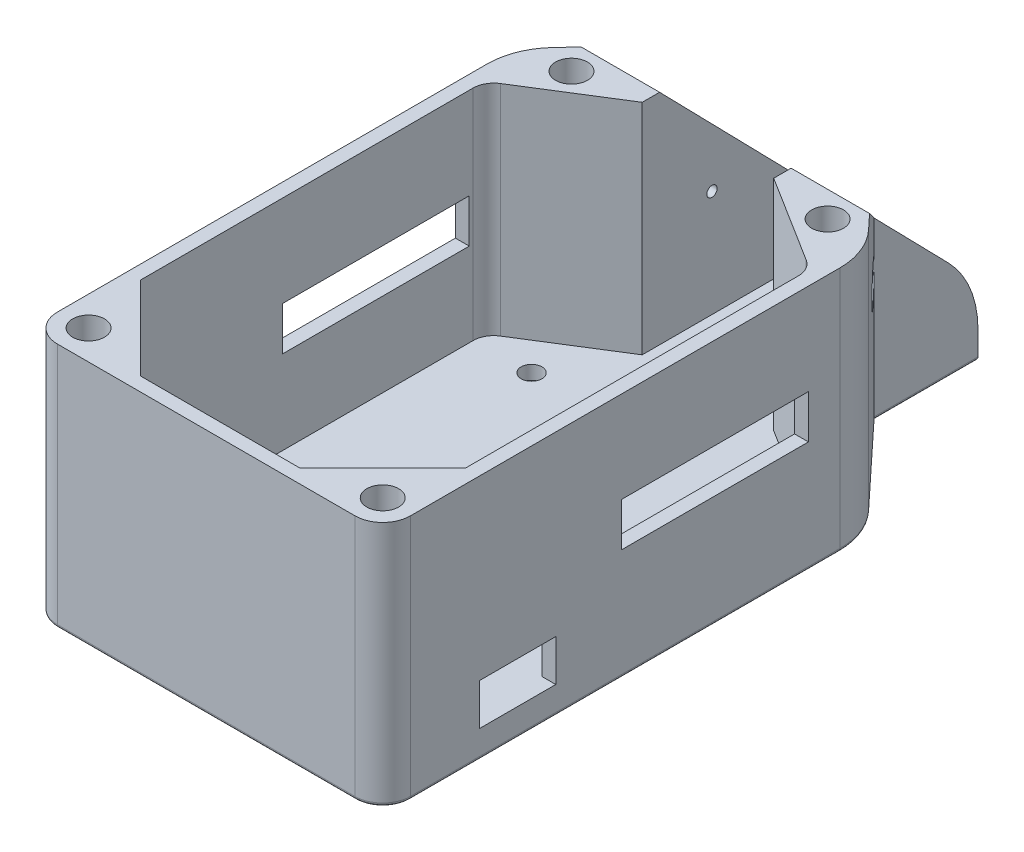
from build123d import *

# Parameters (mm, degrees)
SKETCH1_R               = 1.25
BOSS_EXTRUDE1_DEPTH     = 4
BOSS_EXTRUDE2_DEPTH     = 31.6
CUT_EXTRUDE1_DEPTH      = 119.025653029
FILLET1_R               = 15
FILLET2_R               = 3
FILLET3_R               = 3
SKETCH4_R               = 3.25
CUT_EXTRUDE2_DEPTH      = 2
SKETCH5_R               = 1.5
CUT_EXTRUDE3_DEPTH      = 117.536856073
CHAMFER1_SIZE           = 12
SKETCH6_R               = 2.3
CUT_EXTRUDE4_DEPTH      = 7
FILLET4_R               = 10
FILLET5_R               = 4
CUT_EXTRUDE5_DEPTH      = 113.685645816
CUT_EXTRUDE5_DEPTH_BACK = 113.685645816
SKETCH8_R               = 0.75
SKETCH9_R               = 2.5
CUT_EXTRUDE6_DEPTH      = 113.685645816
CUT_EXTRUDE7_START      = -23
SKETCH9_2_R             = 2.5
CUT_EXTRUDE7_DEPTH      = 90.685645816
SKETCH10_W              = 27
SKETCH10_H              = 6.3
CUT_EXTRUDE8_DEPTH      = 119.025653029
FILLET6_R               = 0.5
SKETCH11_W              = 11
SKETCH11_H              = 6
CUT_EXTRUDE9_DEPTH      = 118.175316416


with BuildPart() as part:
    # Sketch1 → Boss-Extrude1 (new body)
    # profile 1 of 3: a face of its own
    with BuildSketch(Plane.XZ.offset(17.94547529)):
        Polygon((3.055310961, 4.151096428), (26.055310961, 4.151096428), (26.055310961, 19.151096428), (40.055310961, 34.151096428), (40.055310961, 104.151096428), (-10.944689039, 104.151096428), (-10.944689039, 34.151096428), (3.055310961, 19.151096428), align=None)
        with BuildLine():
            ThreePointArc((1.805310961, 41.901096428), (1.47037447, 40.651096428), (0.555310961, 39.736032919))
            ThreePointArc((0.555310961, 39.736032919), (-0.694689039, 39.401096428), (-1.944689039, 39.736032919))
            ThreePointArc((-1.944689039, 39.736032919), (-2.859752549, 40.651096428), (-3.194689039, 41.901096428))
            ThreePointArc((-3.194689039, 41.901096428), (-2.859752549, 43.151096428), (-1.944689039, 44.066159938))
            ThreePointArc((-1.944689039, 44.066159938), (-0.694689039, 44.401096428), (0.555310961, 44.066159938))
            ThreePointArc((0.555310961, 44.066159938), (1.47037447, 43.151096428), (1.805310961, 41.901096428))
        make_face(mode=Mode.SUBTRACT)
    # profile 2 of 3: a face of its own
    with BuildSketch(Plane.XZ.offset(17.94547529)):
        with BuildLine():
            ThreePointArc((-1.944689039, 39.736032919), (-0.694689039, 39.401096428), (0.555310961, 39.736032919))
            ThreePointArc((0.555310961, 39.736032919), (1.47037447, 40.651096428), (1.805310961, 41.901096428))
            ThreePointArc((1.805310961, 41.901096428), (1.47037447, 43.151096428), (0.555310961, 44.066159938))
            ThreePointArc((0.555310961, 44.066159938), (-0.694689039, 44.401096428), (-1.944689039, 44.066159938))
            ThreePointArc((-1.944689039, 44.066159938), (-2.859752549, 43.151096428), (-3.194689039, 41.901096428))
            ThreePointArc((-3.194689039, 41.901096428), (-2.859752549, 40.651096428), (-1.944689039, 39.736032919))
        make_face()
        with Locations((-0.694689039, 41.901096428)):
            Circle(SKETCH1_R, mode=Mode.SUBTRACT)
    # profile 3 of 3: a face of its own
    with BuildSketch(Plane.XZ.offset(17.94547529)):
        with Locations((-0.694689039, 41.901096428)):
            Circle(SKETCH1_R)
    extrude(amount=BOSS_EXTRUDE1_DEPTH)

    # Sketch2 → Boss-Extrude2 (add)
    with BuildSketch(Plane(origin=(0, -17.94547529, 0), x_dir=(1, 0, 0), z_dir=(0, 1, 0))):
        Polygon((3.055310961, -4.151096428), (3.055310961, -19.151096428), (-10.944689039, -34.151096428), (-10.944689039, -104.151096428), (40.055310961, -104.151096428), (40.055310961, -34.151096428), (26.055310961, -19.151096428), (26.055310961, -4.151096428), align=None)
        Polygon((5.055310961, -31.664156806), (5.055310961, -6.151096428), (24.055310961, -6.151096428), (24.055310961, -31.664156806), (38.055310961, -40.43942279), (38.055310961, -102.151096428), (-8.944689039, -102.151096428), (-8.944689039, -40.43942279), align=None, mode=Mode.SUBTRACT)
    extrude(amount=BOSS_EXTRUDE2_DEPTH)

    # Sketch3 → Cut-Extrude1 (cut, through all)
    with BuildSketch(Plane.ZY.offset(10.944689039)):
        Polygon((29.151096428, 13.65452471), (4.151096428, -11.94547529), (4.151096428, 13.65452471), align=None)
    extrude(amount=-CUT_EXTRUDE1_DEPTH, mode=Mode.SUBTRACT)

    # Fillet1
    # the kernel refuses this fillet: 15 mm, written as the material it takes off along each edge
    with BuildSketch(Plane(origin=(-12.217866698, -11.94547529, 4.151096428), x_dir=(0, 0.7154411509611464, 0.6986729989854984), z_dir=(1, 0, 0))) as fillet1_piece_1:
        with BuildLine():
            CenterArc((FILLET1_R * 0.40728473757, FILLET1_R), FILLET1_R, 225.679364755, 44.320635245)
            Line((-FILLET1_R * 0.291388261416, FILLET1_R * 0.284558849039), (0, 0))
            Line((0, 0), (FILLET1_R * 0.40728473757, 0))
        make_face()
    extrude(amount=53.546355318, mode=Mode.SUBTRACT)

    # Fillet2
    fillet2_edges = [part.edges().sort_by_distance(p)[0] for p in [
        (5.055310961, -14.258453435, 6.151096428),
        (24.055310961, -14.258453435, 6.151096428),
    ]]
    fillet(fillet2_edges, radius=FILLET2_R)

    # Fillet3
    fillet3_edges = [part.edges().sort_by_distance(p)[0] for p in [
        (-8.944689039, -2.14547529, 40.43942279),
        (38.055310961, -2.14547529, 40.43942279),
    ]]
    fillet(fillet3_edges, radius=FILLET3_R)

    # Sketch4 → Cut-Extrude2 (cut)
    with BuildSketch(Plane.XZ.offset(21.94547529)):
        with Locations(Location((-0.694689039, 41.901096428, 0), (0, 0, 270))):
            Circle(SKETCH4_R)
        with Locations(Location((-0.694689039, 72.401096428, 0), (0, 0, 270))):
            Circle(SKETCH4_R)
        with Locations(Location((29.805310961, 72.401096428, 0), (0, 0, 270))):
            Circle(SKETCH4_R)
        with Locations(Location((29.805310961, 41.901096428, 0), (0, 0, 270))):
            Circle(SKETCH4_R)
    extrude(amount=-CUT_EXTRUDE2_DEPTH, mode=Mode.SUBTRACT)

    # Sketch5 → Cut-Extrude3 (cut, through all)
    with BuildSketch(Plane.XZ.offset(19.94547529)):
        with Locations(Location((-0.694689039, 41.901096428, 0), (0, 0, 270))):
            Circle(SKETCH5_R)
        with Locations(Location((-0.694689039, 72.401096428, 0), (0, 0, 270))):
            Circle(SKETCH5_R)
        with Locations(Location((29.805310961, 72.401096428, 0), (0, 0, 270))):
            Circle(SKETCH5_R)
        with Locations(Location((29.805310961, 41.901096428, 0), (0, 0, 270))):
            Circle(SKETCH5_R)
    extrude(amount=-CUT_EXTRUDE3_DEPTH, mode=Mode.SUBTRACT)

    # Chamfer1
    chamfer1_edges = [part.edges().sort_by_distance(p)[0] for p in [
        (-8.944689039, -2.14547529, 102.151096428),
        (38.055310961, -2.14547529, 102.151096428),
    ]]
    chamfer(chamfer1_edges, length=CHAMFER1_SIZE)

    # Sketch6 → Cut-Extrude4 (cut)
    with BuildSketch(Plane(origin=(0, 13.65452471, 0), x_dir=(1, 0, 0), z_dir=(0, 1, 0))):
        with Locations(Location((33.055310961, -32.881452384, 0), (0, 0, 270))):
            Circle(SKETCH6_R)
        with Locations(Location((-3.944689039, -32.881452384, 0), (0, 0, 270))):
            Circle(SKETCH6_R)
        with Locations(Location((35.805310961, -99.901096428, 0), (0, 0, 270))):
            Circle(SKETCH6_R)
        with Locations(Location((-6.694689039, -99.901096428, 0), (0, 0, 270))):
            Circle(SKETCH6_R)
    extrude(amount=-CUT_EXTRUDE4_DEPTH, mode=Mode.SUBTRACT)

    # Fillet4
    fillet4_edges = [part.edges().sort_by_distance(p)[0] for p in [
        (-10.944689039, -4.14547529, 34.151096428),
        (40.055310961, -4.14547529, 34.151096428),
    ]]
    fillet(fillet4_edges, radius=FILLET4_R)

    # Fillet5
    fillet5_edges = [part.edges().sort_by_distance(p)[0] for p in [
        (-10.944689039, -4.14547529, 104.151096428),
        (40.055310961, -4.14547529, 104.151096428),
    ]]
    fillet(fillet5_edges, radius=FILLET5_R)

    # Sketch8 → Cut-Extrude5 (cut, two sides: drawn at the far end of the back side and taken through both)
    with BuildSketch(Plane.ZY.offset(-3.055310961).offset(-CUT_EXTRUDE5_DEPTH_BACK)):
        with Locations((21.586066765, -2.525992097)):
            Circle(SKETCH8_R)
    extrude(amount=CUT_EXTRUDE5_DEPTH + CUT_EXTRUDE5_DEPTH_BACK, mode=Mode.SUBTRACT)

    # Sketch9 → Cut-Extrude6 (cut, through all)
    with BuildSketch(Plane.ZY.offset(-3.055310961)):
        with Locations((21.586066765, -2.525992097)):
            Circle(SKETCH9_R)
    extrude(amount=CUT_EXTRUDE6_DEPTH, mode=Mode.SUBTRACT)

    # Sketch9<2> → Cut-Extrude7 (cut, through all)
    with BuildSketch(Plane.ZY.offset(-3.055310961).offset(CUT_EXTRUDE7_START)):
        with Locations((21.586066765, -2.525992097)):
            Circle(SKETCH9_2_R)
    extrude(amount=-CUT_EXTRUDE7_DEPTH, mode=Mode.SUBTRACT)

    # Sketch10 → Cut-Extrude8 (cut, through all)
    with BuildSketch(Plane.ZY.offset(10.944689039)):
        with Locations((56.151096428, -2.69547529)):
            Rectangle(SKETCH10_W, SKETCH10_H)
    extrude(amount=-CUT_EXTRUDE8_DEPTH, mode=Mode.SUBTRACT)

    # Fillet6
    fillet6_edges = [part.edges().sort_by_distance(p)[0] for p in [
        (3.055310961, -21.94547529, 11.651096428),
        (14.555310961, -21.94547529, 4.151096428),
        (29.805310961, -21.94547529, 45.151096428),
        (29.805310961, -21.94547529, 75.651096428),
        (-0.694689039, -21.94547529, 75.651096428),
        (-0.694689039, -21.94547529, 45.151096428),
        (26.055310961, -21.94547529, 11.651096428),
        (40.055310961, -21.94547529, 69.121912331),
        (31.710587302, -21.94547529, 25.21032108),
        (-10.944689039, -21.94547529, 69.121912331),
        (-10.248062804, -21.94547529, 34.425680841),
        (39.358684726, -21.94547529, 34.425680841),
        (14.555310961, -21.94547529, 104.151096428),
        (-9.773116164, -21.94547529, 102.979523553),
        (38.883738086, -21.94547529, 102.979523553),
        (-2.59996538, -21.94547529, 25.21032108),
    ]]
    fillet(fillet6_edges, radius=FILLET6_R)

    # Sketch11 → Cut-Extrude9 (cut, through all)
    with BuildSketch(Plane.ZY.offset(-38.055310961)):
        with Locations((84.651096428, -14.94547529)):
            Rectangle(SKETCH11_W, SKETCH11_H)
    extrude(amount=-CUT_EXTRUDE9_DEPTH, mode=Mode.SUBTRACT)


solid = part.part
